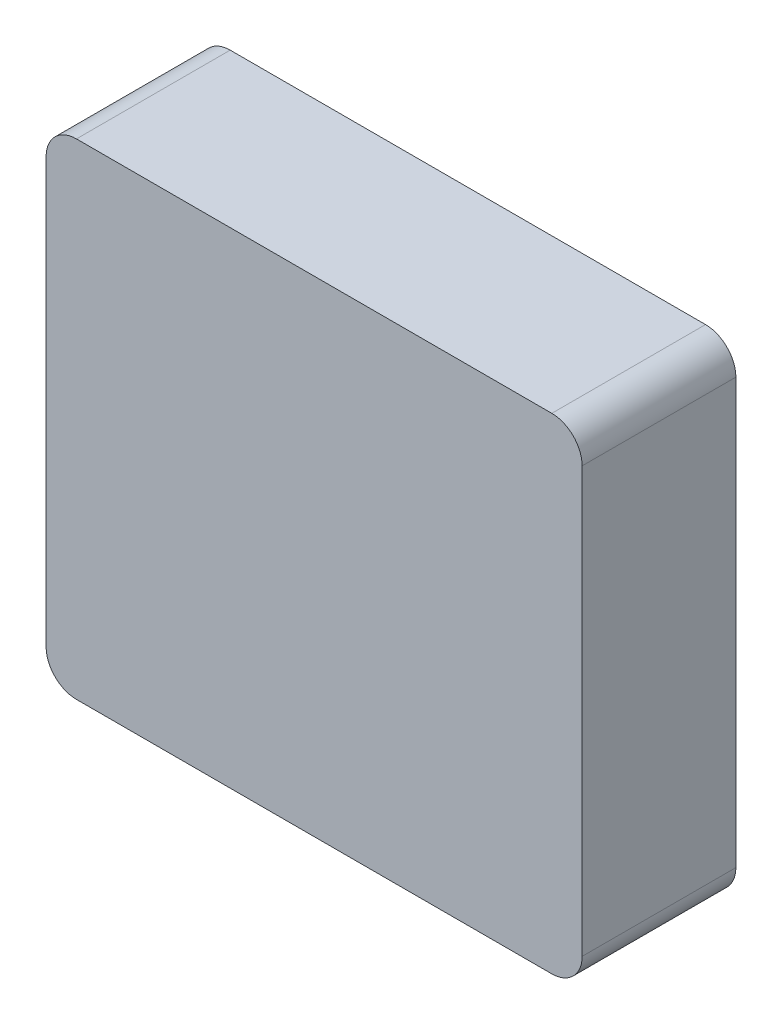
from build123d import *

# Parameters (mm, degrees)
EXTRUDE_1_DEPTH      = 3.5
EXTRUDE_1_DEPTH_BACK = 11.7
SKETCH_1_W           = 53
SKETCH_1_H           = 48
CUT_EXTRUDE_START    = -1.6
CUT_EXTRUDE_1_DEPTH  = 1.6
CUT_EXTRUDE_2_DEPTH  = 2
SKETCH_5_R           = 2
CUT_EXTRUDE_3_DEPTH  = 0.8
FILLET_2_R           = 1.5
FILLET_1_R           = 3
CUT_EXTRUDE_4_DEPTH  = 38.15185056
CUT_EXTRUDE_6_REACH  = 58.064
CUT_EXTRUDE_8_REACH  = 56.752
SKETCH_8_W           = 2.9
SKETCH_8_H           = 1.5
CUT_EXTRUDE_7_DEPTH  = 2.5
EXTRUDE_2_DEPTH      = 1.5


# Read off the part's stored shape, not the designer's step: 切除-旋转2
with BuildPart() as part:
    # 草图1 → 凸台-拉伸1 (new, two sides: drawn at the far end of the back side and taken through both)
    with BuildSketch(Plane.XY.offset(-EXTRUDE_1_DEPTH_BACK)):
        Rectangle(SKETCH_1_W, SKETCH_1_H)
    extrude(amount=EXTRUDE_1_DEPTH + EXTRUDE_1_DEPTH_BACK)

    # 草图2 → 切除-拉伸1 (cut)
    with BuildSketch(Plane.XY.offset(CUT_EXTRUDE_START)):
        Polygon((-25.04302926, 22.538726334), (-25.04302926, -22.461273666), (24.95697074, -22.461273666), (24.95697074, 19.538726334), (21.95697074, 22.538726334), align=None)
    extrude(amount=CUT_EXTRUDE_1_DEPTH, mode=Mode.SUBTRACT)

    # 草图3 → 切除-拉伸2 (cut)
    with BuildSketch(Plane.XY):
        Polygon((-23.04302926, 20.538726334), (-23.04302926, -20.461273666), (22.95697074, -20.461273666), (22.95697074, 18.710299209), (21.128543615, 20.538726334), align=None)
    extrude(amount=CUT_EXTRUDE_2_DEPTH, mode=Mode.SUBTRACT)

    # 草图5 → 切除-拉伸3 (cut)
    with BuildSketch(Plane(origin=(0, 0, 2), x_dir=(-1, 0, 0), z_dir=(0, 0, -1))):
        with Locations((0, 10.596648324)):
            Circle(SKETCH_5_R)
        with Locations((-4.257893586, 14.765199175)):
            Circle(SKETCH_5_R)
        with Locations((-9.74067964, 16.855011719)):
            Circle(SKETCH_5_R)
        with Locations((-15.42583133, 15.403354164)):
            Circle(SKETCH_5_R)
        with Locations((-19.235519258, 10.94078346)):
            Circle(SKETCH_5_R)
        with Locations((-19.777365172, 5.098295771)):
            Circle(SKETCH_5_R)
        with Locations((-16.859691363, 0.004679646)):
            Circle(SKETCH_5_R)
        with Locations((-12.644768522, -4.210243195)):
            Circle(SKETCH_5_R)
        with Locations((-8.429845681, -8.425166036)):
            Circle(SKETCH_5_R)
        with Locations((-4.21492284, -12.640088876)):
            Circle(SKETCH_5_R)
        with Locations((0, -16.855011717)):
            Circle(SKETCH_5_R)
        with Locations((4.21492284, -12.640088877)):
            Circle(SKETCH_5_R)
        with Locations((8.429845681, -8.425166037)):
            Circle(SKETCH_5_R)
        with Locations((12.644768522, -4.210243196)):
            Circle(SKETCH_5_R)
        with Locations((16.859691363, 0.004679645)):
            Circle(SKETCH_5_R)
        with Locations((19.777365172, 5.09829577)):
            Circle(SKETCH_5_R)
        with Locations((19.235519258, 10.940783459)):
            Circle(SKETCH_5_R)
        with Locations((15.425831331, 15.403354163)):
            Circle(SKETCH_5_R)
        with Locations((9.740679641, 16.855011718)):
            Circle(SKETCH_5_R)
        with Locations((4.257893587, 14.765199175)):
            Circle(SKETCH_5_R)
    extrude(amount=-CUT_EXTRUDE_3_DEPTH, mode=Mode.SUBTRACT)

    # 圆角2
    fillet_2_edges = [part.edges().sort_by_distance(p)[0] for p in [
        (24.95697074, -22.461273666, -0.8),
        (-25.04302926, -22.461273666, -0.8),
        (-25.04302926, 22.538726334, -0.8),
        (-23.04302926, 20.538726334, 1),
        (-23.04302926, -20.461273666, 1),
        (22.95697074, -20.461273666, 1),
    ]]
    fillet(fillet_2_edges, radius=FILLET_2_R)

    # 圆角1
    fillet_1_edges = [part.edges().sort_by_distance(p)[0] for p in [
        (26.5, 24, -4.1),
        (-26.5, 24, -4.1),
        (-26.5, -24, -4.1),
        (26.5, -24, -4.1),
    ]]
    fillet(fillet_1_edges, radius=FILLET_1_R)

    # 草图6 → 切除-拉伸4 (cut, through all)
    with BuildSketch(Plane.XY.offset(-1.6)):
        with BuildLine():
            Line((-23.54302926, -22.461273666), (23.45697074, -22.461273666))
            ThreePointArc((23.45697074, -22.461273666), (24.517630912, -22.021933838), (24.95697074, -20.961273666))
            Line((24.95697074, -20.961273666), (24.95697074, 21.038726334))
            ThreePointArc((24.95697074, 21.038726334), (24.517630912, 22.099386506), (23.45697074, 22.538726334))
            Line((23.45697074, 22.538726334), (-23.54302926, 22.538726334))
            ThreePointArc((-23.54302926, 22.538726334), (-24.603689432, 22.099386506), (-25.04302926, 21.038726334))
            Line((-25.04302926, 21.038726334), (-25.04302926, -20.961273666))
            ThreePointArc((-25.04302926, -20.961273666), (-24.603689432, -22.021933838), (-23.54302926, -22.461273666))
        make_face()
    extrude(amount=-CUT_EXTRUDE_4_DEPTH, mode=Mode.SUBTRACT)

    # 草图7 → 切除-拉伸6 (cut, up to next)
    with BuildSketch(Plane.XZ.offset(24), mode=Mode.PRIVATE) as cut_extrude_6_sk1:
        with BuildLine():
            Line((2.9, -2.8), (-2.9, -2.8))
            ThreePointArc((-2.9, -2.8), (-5, -4.9), (-2.9, -7))
            Line((-2.9, -7), (2.9, -7))
            ThreePointArc((2.9, -7), (5, -4.9), (2.9, -2.8))
        make_face()
    cut_extrude_6_tool1 = extrude(cut_extrude_6_sk1.sketch, amount=-CUT_EXTRUDE_6_REACH, mode=Mode.PRIVATE) & part.part
    add(cut_extrude_6_tool1.solids().sort_by_distance((0, -24, -4.9))[0], mode=Mode.SUBTRACT)

    # 草图8 → 切除-拉伸8 (cut, up to next)
    with BuildSketch(Plane.XZ.offset(22.461273666), mode=Mode.PRIVATE) as cut_extrude_8_sk1:
        with Locations((-16.99302926, -2.35)):
            Rectangle(SKETCH_8_W, SKETCH_8_H)
    cut_extrude_8_tool1 = extrude(cut_extrude_8_sk1.sketch, amount=CUT_EXTRUDE_8_REACH, mode=Mode.PRIVATE) & part.part
    add(cut_extrude_8_tool1.solids().sort_by_distance((-16.993029, -22.461274, -2.35))[0], mode=Mode.SUBTRACT)

    # 草图11 → 切除-拉伸7 (cut, symmetric)
    with BuildSketch(Plane.ZY.offset(16.99302926)):
        with BuildLine():
            Line((-1.6, -22.961273666), (-3.1, -22.961273666))
            ThreePointArc((-3.1, -22.961273666), (-4.339097696, -23.233488179), (-5.35, -24))
            Line((-5.35, -24), (0.65, -24))
            ThreePointArc((0.65, -24), (-0.360902304, -23.233488179), (-1.6, -22.961273666))
        make_face()
    extrude(amount=CUT_EXTRUDE_7_DEPTH, both=True, mode=Mode.SUBTRACT)

    # 草图12 → 切除-旋转1 (revolve, cut)
    with BuildSketch(Plane(origin=(-19.49302926, 0, 0), x_dir=(0, 0, -1), z_dir=(1, 0, 0))):
        with BuildLine():
            Line((-0.65, -24), (5.35, -24))
            ThreePointArc((5.35, -24), (4.339097696, -23.233488179), (3.1, -22.961273666))
            Line((3.1, -22.961273666), (1.6, -22.961273666))
            ThreePointArc((1.6, -22.961273666), (0.360902304, -23.233488179), (-0.65, -24))
        make_face()
    revolve(axis=Axis((-19.49302926, -24, 0.65), (0, 0, -1)), mode=Mode.SUBTRACT)

    # 切除-旋转2 outline → 切除-旋转2 (revolve, cut)
    with BuildSketch(Plane(origin=(-14.49302926, -24, 0), x_dir=(1, 0, 0), z_dir=(0, -1, 0))):
        with BuildLine():
            add(Edge.make_bspline(
                [(1.038726334, -3.1), (1.038726334, -4.464767199), (0, -5.35)],
                knots=[0, 0, 0, 0.865009582, 0.865009582, 0.865009582], degree=2, weights=[1, 0.907918725, 1]))
            Line((1.038726334, -3.1), (1.038726334, -1.6))
            add(Edge.make_bspline(
                [(0, 0.65), (1.038726334, -0.235232801), (1.038726334, -1.6)],
                knots=[5.418175725, 5.418175725, 5.418175725, 6.283185307, 6.283185307, 6.283185307], degree=2, weights=[1, 0.907918725, 1]))
            Line((0, 0.65), (0, -5.35))
        make_face()
    revolve(axis=Axis((-14.49302926, -24, 0), (0, 0, 1)), mode=Mode.SUBTRACT)

    # 草图14 → 凸台-拉伸2 (add)
    with BuildSketch(Plane(origin=(0, 0, -11.7), x_dir=(-1, 0, 0), z_dir=(0, 0, -1))):
        with BuildLine():
            Line((-26.5, 21), (-26.5, -21))
            ThreePointArc((-26.5, -21), (-25.621320344, -23.121320344), (-23.5, -24))
            Line((-23.5, -24), (23.5, -24))
            ThreePointArc((23.5, -24), (25.621320344, -23.121320344), (26.5, -21))
            Line((26.5, -21), (26.5, 21))
            ThreePointArc((26.5, 21), (25.621320344, 23.121320344), (23.5, 24))
            Line((23.5, 24), (-23.5, 24))
            ThreePointArc((-23.5, 24), (-25.621320344, 23.121320344), (-26.5, 21))
        make_face()
    extrude(amount=-EXTRUDE_2_DEPTH)


solid = part.part
